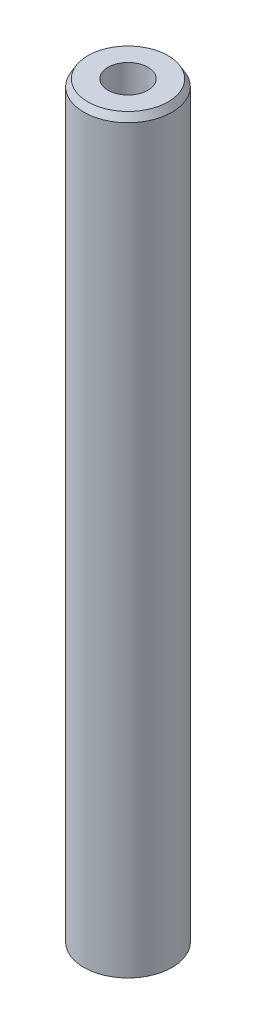
from build123d import *
from OCP.BRepFilletAPI import BRepFilletAPI_MakeChamfer

# Parameters (mm, degrees)
SKETCH1_R           = 35
BOSS_EXTRUDE1_DEPTH = 596.40681065
SKETCH2_R           = 15.82221519
CUT_EXTRUDE1_DEPTH  = 599.457253102
CHAMFER1_SIZE       = 5.491782963
CHAMFER1_SIZE2      = 3.170682372


with BuildPart() as part:
    # Sketch1 → Boss-Extrude1 (new body)
    with BuildSketch(Plane(origin=(0, 0, 0), x_dir=(1, 0, 0), z_dir=(0, 1, 0))):
        Circle(SKETCH1_R)
    extrude(amount=BOSS_EXTRUDE1_DEPTH)

    # Sketch2 → Cut-Extrude1 (cut, through all)
    with BuildSketch(Plane(origin=(0, 0, 0), x_dir=(1, 0, 0), z_dir=(0, 1, 0))):
        Circle(SKETCH2_R)
    extrude(amount=CUT_EXTRUDE1_DEPTH, mode=Mode.SUBTRACT)

    # Chamfer1: one chamfer whose edges measure the first distance from different faces: ONE call of the kernel's chamfer builder (chamfer() names one face for all edges)
    chamfer1_edges_1 = [part.edges().sort_by_distance(p)[0] for p in [
        (-35, 596.40681065, 0),
    ]]
    chamfer1_side_1 = [part.faces().sort_by_distance(p)[0] for p in [
        (-35, 298.203405325, 0),
    ]]
    chamfer1_edges_2 = [part.edges().sort_by_distance(p)[0] for p in [
        (-35, 0, 0),
    ]]
    chamfer1_side_2 = [part.faces().sort_by_distance(p)[0] for p in [
        (-34.010050506, 0, 0),
    ]]
    chamfer1 = BRepFilletAPI_MakeChamfer(part.part.solid().wrapped)
    for e in chamfer1_edges_1:
        chamfer1.Add(CHAMFER1_SIZE, CHAMFER1_SIZE2, e.wrapped, chamfer1_side_1[0].wrapped)  # the first distance lies on this face
    for e in chamfer1_edges_2:
        chamfer1.Add(CHAMFER1_SIZE, CHAMFER1_SIZE2, e.wrapped, chamfer1_side_2[0].wrapped)  # the first distance lies on this face
    add(Compound.cast(chamfer1.Shape()), mode=Mode.REPLACE)


solid = part.part
